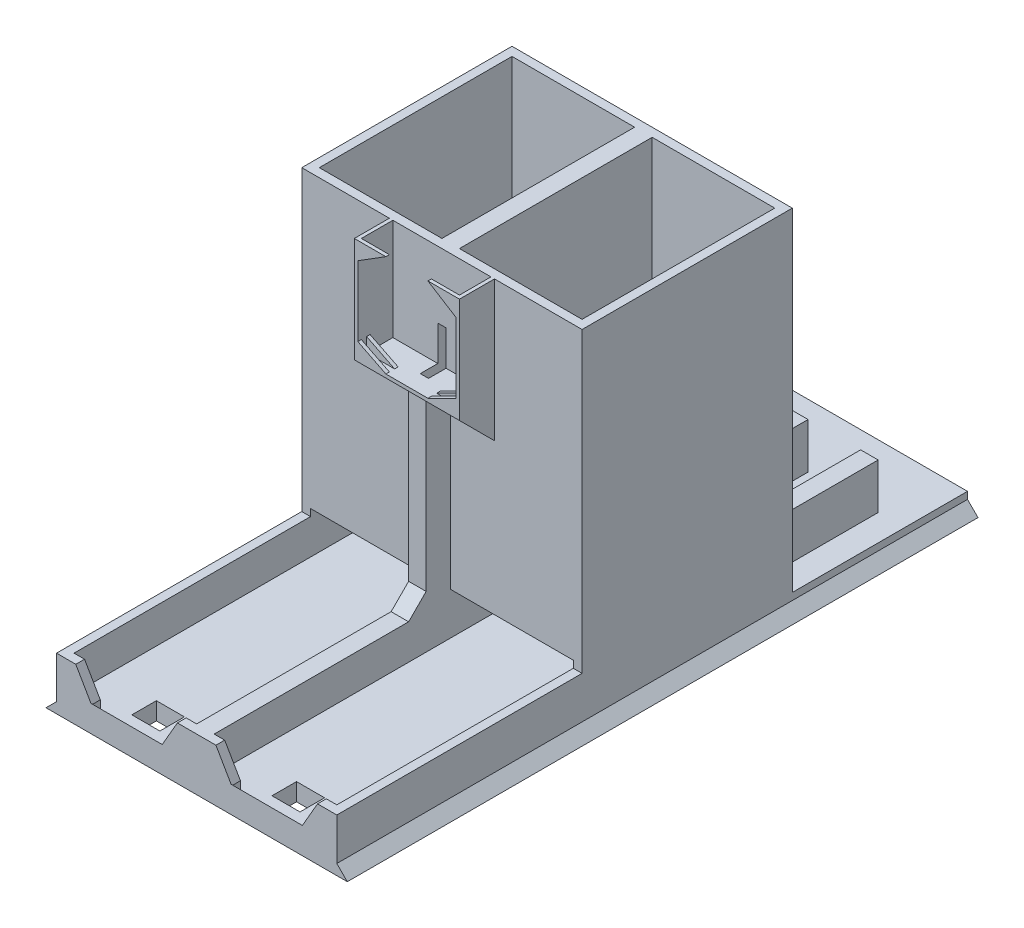
from build123d import *

# Parameters (mm, degrees)
SKETCH1_W                                 = 80
SKETCH1_H                                 = 60
BOSS_EXTRUDE1_DEPTH                       = 100
CUT_EXTRUDE1_START                        = 5
SKETCH2_W                                 = 35
SKETCH2_H                                 = 55
CUT_EXTRUDE1_DEPTH                        = 95
SKETCH3_W                                 = 80
SKETCH3_H                                 = 5
BOSS_EXTRUDE2_DEPTH                       = 70
BOSS_EXTRUDE3_DEPTH                       = 10
SKETCH5_W                                 = 20
SKETCH5_H                                 = 2.5
CUT_EXTRUDE2_DEPTH                        = 7.5
SKETCH6_W                                 = 35
SKETCH6_H                                 = 12
CUT_EXTRUDE4_DEPTH                        = 57.5
CUT_EXTRUDE6_REACH                        = 184.483
SKETCH7_R                                 = 4
SKETCH9_W                                 = 80
SKETCH9_H                                 = 50
BOSS_EXTRUDE4_DEPTH                       = 5
SKETCH13_W                                = 8
SKETCH13_H                                = 7
CUT_EXTRUDE8_BUTTON_HOLES_DEPTH           = 166.90660023
BOSS_EXTRUDE5_OLED_MOUNT_DEPTH            = 10
BOSS_EXTRUDE6_OLED_MOUNT_DEPTH            = 1
BOSS_EXTRUDE7_START                       = -2.5
BOSS_EXTRUDE7_OLED_MOUNT_DEPTH            = 1
BOSS_EXTRUDE8_OLED_MOUNT_DEPTH            = 1
BOSS_EXTRUDE13_OLED_MOUNT_SUPPORT_DEPTH   = 30
CUT_EXTRUDE9_OLED_CABLE_DEPTH             = 10
CUT_EXTRUDE9_OLED_CABLE_DEPTH_BACK        = 154.430766146
SKETCH18_W                                = 2.36
SKETCH18_H                                = 8
BOSS_EXTRUDE12_OLED_CABLE_GUIDE_REACH     = 162.39
SKETCH20_W                                = 10
SKETCH20_H                                = 10
CUT_EXTRUDE10_SOLENOID_WIRE_HOLE_DEPTH    = 166.90660023
SKETCH21_W                                = 5
SKETCH21_H                                = 32
BOSS_EXTRUDE9_SOLENOID_SIDE_SUPPORT_DEPTH = 13
CHAMFER3_THUMB_SIZE                       = 2.5
CHAMFER5_THUMB_SIZE                       = 4.5
CHAMFER5_THUMB_SIZE2                      = 7.794228634
CHAMFER5_THUMB_PART_2_SIZE                = 4.5
CHAMFER5_THUMB_PART_2_SIZE2               = 7.794228634
CHAMFER5_THUMB_PART_3_SIZE                = 4.5
CHAMFER5_THUMB_PART_3_SIZE2               = 7.794228634
BOSS_EXTRUDE5_GUIDE_DEPTH                 = 180
SKETCH49_W                                = 5
SKETCH49_H                                = 5
BOSS_EXTRUDE14_DEPTH                      = 5
CHAMFER8_SIZE                             = 5


with BuildPart() as part:
    # Sketch1 → Boss-Extrude1 (new body)
    with BuildSketch(Plane(origin=(0, 0, 0), x_dir=(1, 0, 0), z_dir=(0, 1, 0))):
        with Locations((40, 30)):
            Rectangle(SKETCH1_W, SKETCH1_H)
    extrude(amount=BOSS_EXTRUDE1_DEPTH)

    # Sketch2 → Cut-Extrude1 (cut)
    with BuildSketch(Plane(origin=(0, 0, 0), x_dir=(1, 0, 0), z_dir=(0, 1, 0)).offset(CUT_EXTRUDE1_START)):
        with Locations((20, 30)):
            Rectangle(SKETCH2_W, SKETCH2_H)
        with Locations((60, 30)):
            Rectangle(SKETCH2_W, SKETCH2_H)
    extrude(amount=CUT_EXTRUDE1_DEPTH, mode=Mode.SUBTRACT)

    # Sketch3 → Boss-Extrude2 (add)
    with BuildSketch(Plane.XY):
        with Locations((40, 2.5)):
            Rectangle(SKETCH3_W, SKETCH3_H)
    extrude(amount=BOSS_EXTRUDE2_DEPTH)

    # Sketch4 → Boss-Extrude3 (add)
    with BuildSketch(Plane(origin=(0, 5, 0), x_dir=(1, 0, 0), z_dir=(0, 1, 0))):
        Polygon((80, 0), (77.5, 0), (77.5, -67.5), (42.5, -67.5), (42.5, 0), (37.5, 0), (37.5, -67.5), (2.5, -67.5), (2.5, 0), (0, 0), (0, -70), (80, -70), align=None)
    extrude(amount=BOSS_EXTRUDE3_DEPTH)

    # Sketch5 → Cut-Extrude2 (cut)
    with BuildSketch(Plane(origin=(0, 15, 0), x_dir=(1, 0, 0), z_dir=(0, 1, 0))):
        with Locations((20, -68.75)):
            Rectangle(SKETCH5_W, SKETCH5_H)
        with Locations((60, -68.75)):
            Rectangle(SKETCH5_W, SKETCH5_H)
    extrude(amount=-CUT_EXTRUDE2_DEPTH, mode=Mode.SUBTRACT)

    # Sketch6 → Cut-Extrude4 (cut)
    with BuildSketch(Plane.XY):
        with Locations((20, 11)):
            Rectangle(SKETCH6_W, SKETCH6_H)
        with Locations((60, 11)):
            Rectangle(SKETCH6_W, SKETCH6_H)
    extrude(amount=-CUT_EXTRUDE4_DEPTH, mode=Mode.SUBTRACT)

    # Sketch7 → Cut-Extrude6 (cut, up to next)
    with BuildSketch(Plane(origin=(0, 0, -60), x_dir=(-1, 0, 0), z_dir=(0, 0, -1)), mode=Mode.PRIVATE) as cut_extrude6_sk1:
        with Locations((-20, 11.5)):
            Circle(SKETCH7_R)
    cut_extrude6_tool1 = extrude(cut_extrude6_sk1.sketch, amount=-CUT_EXTRUDE6_REACH, mode=Mode.PRIVATE) & part.part
    # Sketch7 → Cut-Extrude6 (cut, up to next)
    with BuildSketch(Plane(origin=(0, 0, -60), x_dir=(-1, 0, 0), z_dir=(0, 0, -1)), mode=Mode.PRIVATE) as cut_extrude6_sk2:
        with Locations((-60, 11.5)):
            Circle(SKETCH7_R)
    cut_extrude6_tool2 = extrude(cut_extrude6_sk2.sketch, amount=-CUT_EXTRUDE6_REACH, mode=Mode.PRIVATE) & part.part
    add(cut_extrude6_tool1.solids().sort_by_distance((20, 11.5, -60))[0], mode=Mode.SUBTRACT)
    add(cut_extrude6_tool2.solids().sort_by_distance((60, 11.5, -60))[0], mode=Mode.SUBTRACT)

    # Sketch9 → Boss-Extrude4 (add)
    with BuildSketch(Plane(origin=(0, 0, 0), x_dir=(1, 0, 0), z_dir=(0, 1, 0))):
        with Locations((40, 85)):
            Rectangle(SKETCH9_W, SKETCH9_H)
    extrude(amount=BOSS_EXTRUDE4_DEPTH)

    # Sketch13 → Cut-Extrude8 (Button Holes) (cut, through all)
    with BuildSketch(Plane(origin=(0, 5, 0), x_dir=(1, 0, 0), z_dir=(0, 1, 0))):
        with Locations((20, -61)):
            Rectangle(SKETCH13_W, SKETCH13_H)
        with Locations((60, -61)):
            Rectangle(SKETCH13_W, SKETCH13_H)
    extrude(amount=-CUT_EXTRUDE8_BUTTON_HOLES_DEPTH, mode=Mode.SUBTRACT)

    # Sketch14 → Boss-Extrude5 (OLED Mount) (add)
    with BuildSketch(Plane.XY):
        Polygon((25, 100), (26, 100), (26, 71), (54, 71), (54, 100), (55, 100), (55, 70), (54, 70), (26, 70), (25, 70), align=None)
    extrude(amount=BOSS_EXTRUDE5_OLED_MOUNT_DEPTH)

    # Sketch15 → Boss-Extrude6 (OLED Mount) (add)
    with BuildSketch(Plane.XY.offset(10)):
        Polygon((26, 71), (34, 71), (26, 75), align=None)
        Polygon((54, 75), (54, 71), (46, 71), align=None)
    extrude(amount=-BOSS_EXTRUDE6_OLED_MOUNT_DEPTH)

    # Sketch15<2> → Boss-Extrude7 (OLED Mount) (add)
    with BuildSketch(Plane.XY.offset(10).offset(BOSS_EXTRUDE7_START)):
        Polygon((26, 71), (34, 71), (26, 75), align=None)
        Polygon((54, 75), (54, 71), (46, 71), align=None)
    extrude(amount=-BOSS_EXTRUDE7_OLED_MOUNT_DEPTH)

    # Sketch17 → Boss-Extrude8 (OLED Mount) (add)
    with BuildSketch(Plane.XY.offset(10)):
        Polygon((54, 95), (54, 100), (46, 100), align=None)
        Polygon((26, 100), (34, 100), (26, 95), align=None)
    extrude(amount=-BOSS_EXTRUDE8_OLED_MOUNT_DEPTH)

    # Sketch32 → Boss-Extrude13 OLED Mount Support) (add)
    with BuildSketch(Plane.ZY.offset(-25)):
        Polygon((0, 70), (10, 70), (0, 60), align=None)
    extrude(amount=-BOSS_EXTRUDE13_OLED_MOUNT_SUPPORT_DEPTH)

    # Sketch18 → Cut-Extrude9 (OLED Cable) (cut, two sides: drawn at the far end of the back side and taken through both)
    with BuildSketch(Plane(origin=(0, 71, 0), x_dir=(1, 0, 0), z_dir=(0, 1, 0)).offset(-CUT_EXTRUDE9_OLED_CABLE_DEPTH_BACK)):
        with Locations((40, -1)):
            Rectangle(SKETCH18_W, SKETCH18_H)
    extrude(amount=CUT_EXTRUDE9_OLED_CABLE_DEPTH + CUT_EXTRUDE9_OLED_CABLE_DEPTH_BACK, mode=Mode.SUBTRACT)

    # Boss-Extrude12 (OLED Cable Guide): up to this plane
    boss_extrude12_oled_cable_guide_end = Plane(origin=(55, 70, 10), z_dir=(0, -0.7071067811865477, 0.7071067811865474))
    # Sketch31 → Boss-Extrude12 (OLED Cable Guide) (add, up to the surface)
    with BuildSketch(Plane(origin=(0, 15, 0), x_dir=(1, 0, 0), z_dir=(0, 1, 0)), mode=Mode.PRIVATE) as boss_extrude12_oled_cable_guide_sk1:
        Polygon((37.5, 0), (38.82, 0), (38.82, -5), (41.18, -5), (41.18, 0), (42.5, 0), (42.5, -7), (37.5, -7), align=None)
    boss_extrude12_oled_cable_guide_tool1 = split(extrude(boss_extrude12_oled_cable_guide_sk1.sketch, amount=BOSS_EXTRUDE12_OLED_CABLE_GUIDE_REACH, mode=Mode.PRIVATE), bisect_by=boss_extrude12_oled_cable_guide_end, keep=Keep.BOTH, mode=Mode.PRIVATE)
    add(boss_extrude12_oled_cable_guide_tool1.solids().sort_by_distance((38.16, 15, 0.086023))[0])

    # Sketch20 → Cut-Extrude10 (Solenoid Wire Hole) (cut, through all)
    with BuildSketch(Plane(origin=(0, 5, 0), x_dir=(1, 0, 0), z_dir=(0, 1, 0))):
        with Locations((60, 65)):
            Rectangle(SKETCH20_W, SKETCH20_H)
        with Locations((20, 65)):
            Rectangle(SKETCH20_W, SKETCH20_H)
    extrude(amount=-CUT_EXTRUDE10_SOLENOID_WIRE_HOLE_DEPTH, mode=Mode.SUBTRACT)

    # Sketch21 → Boss-Extrude9 (Solenoid Side Support) (add)
    with BuildSketch(Plane(origin=(0, 5, 0), x_dir=(1, 0, 0), z_dir=(0, 1, 0))):
        with Locations((70, 76)):
            Rectangle(SKETCH21_W, SKETCH21_H)
        with Locations((50, 76)):
            Rectangle(SKETCH21_W, SKETCH21_H)
        with Locations((30, 76)):
            Rectangle(SKETCH21_W, SKETCH21_H)
        with Locations((10, 76)):
            Rectangle(SKETCH21_W, SKETCH21_H)
    extrude(amount=BOSS_EXTRUDE9_SOLENOID_SIDE_SUPPORT_DEPTH)

    # Chamfer3 (Thumb)
    chamfer3_thumb_edges = [part.edges().sort_by_distance(p)[0] for p in [
        (20, 7.5, 67.5),
        (60, 7.5, 67.5),
    ]]
    chamfer(chamfer3_thumb_edges, length=CHAMFER3_THUMB_SIZE - 0.0001)  # a hair under: the kernel refuses the full size

    # Chamfer5 (Thumb)
    chamfer5_thumb_edges = [part.edges().sort_by_distance(p)[0] for p in [
        (70, 15, 68.75),
    ]]
    chamfer5_thumb_side = [part.faces().sort_by_distance(p)[0] for p in [
        (78.266129032, 15, 38.266129032),
    ]]
    chamfer(chamfer5_thumb_edges, length=CHAMFER5_THUMB_SIZE, length2=CHAMFER5_THUMB_SIZE2, reference=chamfer5_thumb_side[0])

    # Chamfer5 (Thumb) part 2
    chamfer5_thumb_part_2_edges = [part.edges().sort_by_distance(p)[0] for p in [
        (50, 15, 68.75),
        (30, 15, 68.75),
    ]]
    chamfer5_thumb_part_2_side = [part.faces().sort_by_distance(p)[0] for p in [
        (40, 15, 41.718085106),
    ]]
    chamfer(chamfer5_thumb_part_2_edges, length=CHAMFER5_THUMB_PART_2_SIZE, length2=CHAMFER5_THUMB_PART_2_SIZE2, reference=chamfer5_thumb_part_2_side[0])

    # Chamfer5 (Thumb) part 3
    chamfer5_thumb_part_3_edges = [part.edges().sort_by_distance(p)[0] for p in [
        (10, 15, 68.75),
    ]]
    chamfer5_thumb_part_3_side = [part.faces().sort_by_distance(p)[0] for p in [
        (1.733870968, 15, 38.266129032),
    ]]
    chamfer(chamfer5_thumb_part_3_edges, length=CHAMFER5_THUMB_PART_3_SIZE, length2=CHAMFER5_THUMB_PART_3_SIZE2, reference=chamfer5_thumb_part_3_side[0])

    # Sketch37 → Boss-Extrude5 (Guide) (add, through all)
    with BuildSketch(Plane.XY.offset(70)):
        Polygon((80, 0), (83, 0), (80, 3), align=None)
        Polygon((0, 0), (-3, 0), (0, 3), align=None)
    extrude(amount=-BOSS_EXTRUDE5_GUIDE_DEPTH)

    # Sketch49 → Boss-Extrude14 (add)
    with BuildSketch(Plane(origin=(0, 15, 0), x_dir=(1, 0, 0), z_dir=(0, 1, 0))):
        with Locations((40, -9.5)):
            Rectangle(SKETCH49_W, SKETCH49_H)
    extrude(amount=BOSS_EXTRUDE14_DEPTH)

    # Chamfer8
    chamfer8_edges = [part.edges().sort_by_distance(p)[0] for p in [
        (40, 20, 12),
    ]]
    chamfer(chamfer8_edges, length=CHAMFER8_SIZE - 0.0001)  # a hair under: the kernel refuses the full size


solid = part.part
